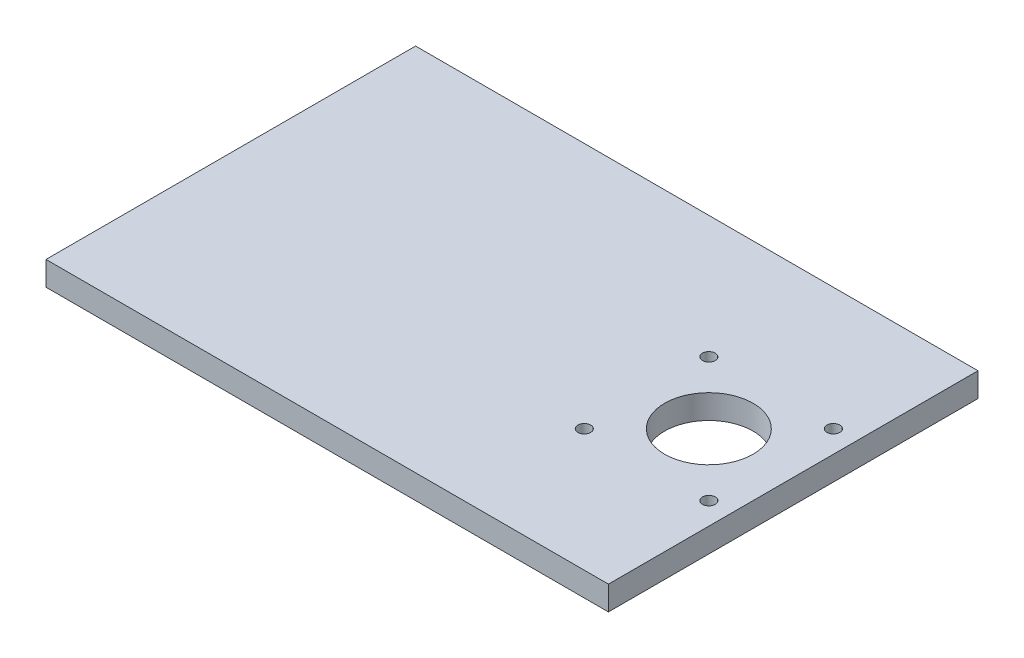
from build123d import *

# Parameters (mm, degrees)
SKETCH1_W           = 140
SKETCH1_H           = 92
BOSS_EXTRUDE1_DEPTH = 6
SKETCH3_R           = 11
SKETCH3_R_2         = 1.6
CUT_EXTRUDE2_DEPTH  = 84.976187101


with BuildPart() as part:
    # Sketch1 → Boss-Extrude1 (new body)
    with BuildSketch(Plane(origin=(0, 0, 0), x_dir=(1, 0, 0), z_dir=(0, 1, 0))):
        Rectangle(SKETCH1_W, SKETCH1_H)
    extrude(amount=BOSS_EXTRUDE1_DEPTH)

    # Sketch3 → Cut-Extrude2 (cut, through all)
    with BuildSketch(Plane(origin=(0, 6, 0), x_dir=(1, 0, 0), z_dir=(0, 1, 0))):
        with Locations((49, 0)):
            Circle(SKETCH3_R)
        with Locations((33.5, -15.5)):
            Circle(SKETCH3_R_2)
        with Locations((33.5, 15.5)):
            Circle(SKETCH3_R_2)
        with Locations((64.5, 15.5)):
            Circle(SKETCH3_R_2)
        with Locations((64.5, -15.5)):
            Circle(SKETCH3_R_2)
    extrude(amount=-CUT_EXTRUDE2_DEPTH, mode=Mode.SUBTRACT)


solid = part.part
